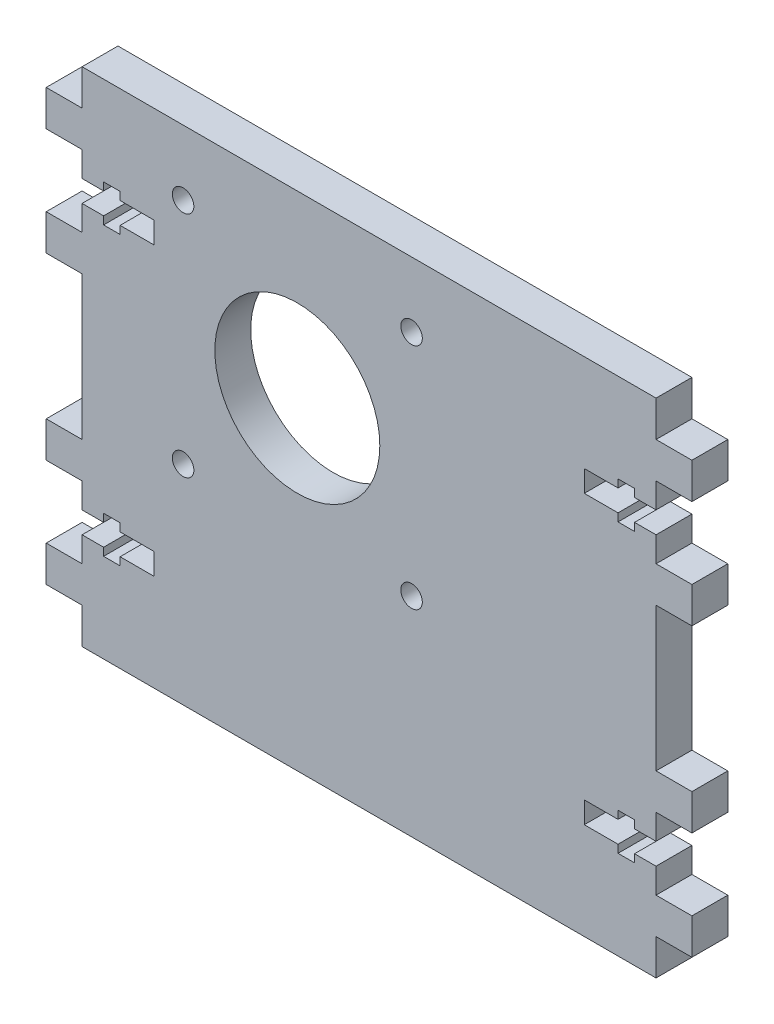
from build123d import *

# Parameters (mm, degrees)
SKETCH1_R           = 1.5
SKETCH1_R_2         = 11.5
BOSS_EXTRUDE1_DEPTH = 5


with BuildPart() as part:
    # Sketch1 → Boss-Extrude1 (new body)
    with BuildSketch(Plane.XY):
        Polygon((0, 70), (-80, 70), (-80, 65), (-85, 65), (-85, 60), (-80, 60), (-80, 56.5), (-77, 56.5), (-77, 57.6), (-74.7, 57.6), (-74.7, 56.5), (-70, 56.5), (-70, 53.5), (-74.7, 53.5), (-74.7, 52.4), (-77, 52.4), (-77, 53.5), (-80, 53.5), (-80, 50), (-85, 50), (-85, 45), (-80, 45), (-80, 25), (-85, 25), (-85, 20), (-80, 20), (-80, 16.5), (-77, 16.5), (-77, 17.6), (-74.7, 17.6), (-74.7, 16.5), (-70, 16.5), (-70, 13.5), (-74.7, 13.5), (-74.7, 12.4), (-77, 12.4), (-77, 13.5), (-80, 13.5), (-80, 10), (-85, 10), (-85, 5), (-80, 5), (-80, 0), (0, 0), (0, 5), (5, 5), (5, 10), (0, 10), (0, 13.5), (-3, 13.5), (-3, 12.4), (-5.3, 12.4), (-5.3, 13.5), (-10, 13.5), (-10, 16.5), (-5.3, 16.5), (-5.3, 17.6), (-3, 17.6), (-3, 16.5), (0, 16.5), (0, 20), (5, 20), (5, 25), (0, 25), (0, 45), (5, 45), (5, 50), (0, 50), (0, 53.5), (-3, 53.5), (-3, 52.4), (-5.3, 52.4), (-5.3, 53.5), (-10, 53.5), (-10, 56.5), (-5.3, 56.5), (-5.3, 57.6), (-3, 57.6), (-3, 56.5), (0, 56.5), (0, 60), (5, 60), (5, 65), (0, 65), align=None)
        with Locations((-65.922, 60.922)):
            Circle(SKETCH1_R, mode=Mode.SUBTRACT)
        with Locations((-34.078, 60.922)):
            Circle(SKETCH1_R, mode=Mode.SUBTRACT)
        with Locations((-34.078, 29.078)):
            Circle(SKETCH1_R, mode=Mode.SUBTRACT)
        with Locations((-65.922, 29.078)):
            Circle(SKETCH1_R, mode=Mode.SUBTRACT)
        with Locations((-50, 45)):
            Circle(SKETCH1_R_2, mode=Mode.SUBTRACT)
    extrude(amount=BOSS_EXTRUDE1_DEPTH)


solid = part.part
